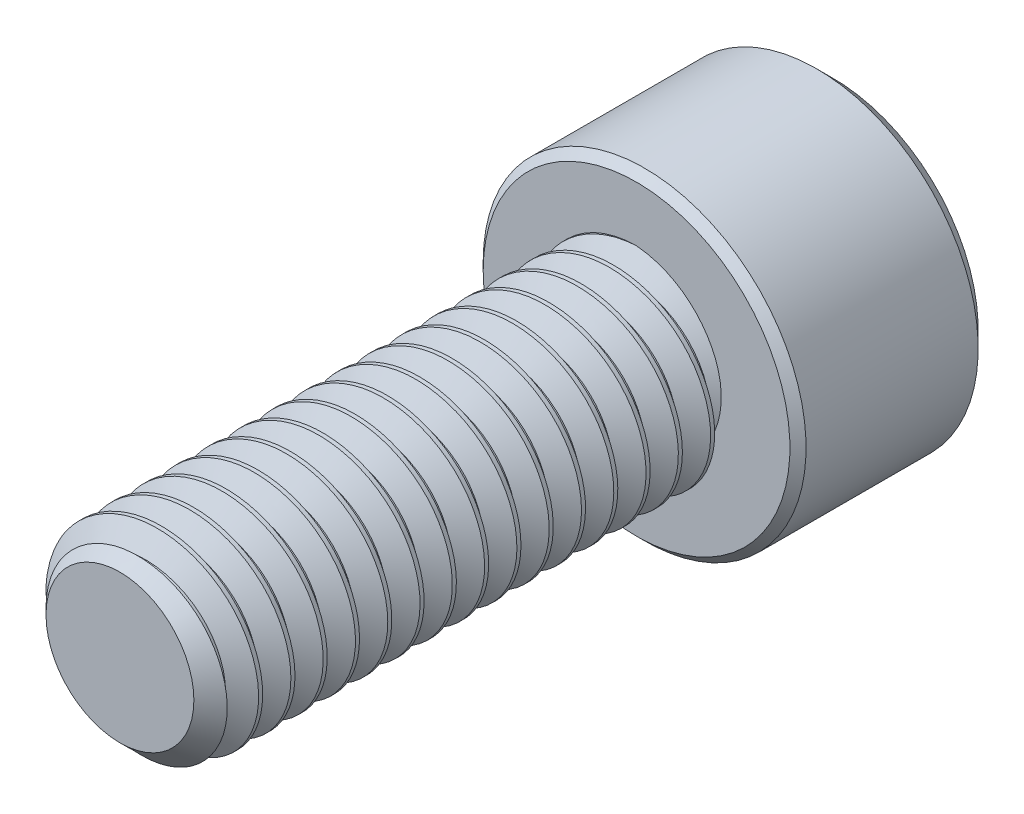
from build123d import *

# Parameters (mm, degrees)
SKETCH1_R          = 2.413
EXTRUDE1_DEPTH     = 12.7
CHAMFER3_SIZE      = 0.5953125
CUT_SWEEP1_PITCH   = 0.79375
SKETCH6_R          = 3.96875
EXTRUDE2_DEPTH     = 4.826
CUT_EXTRUDE1_DEPTH = 2.9765625
CHAMFER1_SIZE      = 0.396875
CHAMFER2_SIZE      = 0.1984375


with BuildPart() as part:
    # Sketch1 → Extrude1 (new body)
    with BuildSketch(Plane.XY):
        Circle(SKETCH1_R)
    extrude(amount=-EXTRUDE1_DEPTH)

    # Chamfer3
    chamfer3_edges = [part.edges().sort_by_distance(p)[0] for p in [
        (-2.413, 0, 0),
    ]]
    chamfer(chamfer3_edges, length=CHAMFER3_SIZE)

    # Cut-Sweep1: the profile of Sketch3 profile screwed along a right-hand helix of 17 turns, 6 arcs to a turn; built about Z, then put on its axis
    cut_sweep1_z = Axis((0, 0, 0), (0, 0, 1))
    cut_sweep1_corners = [(2.4133, 0, -0.694704455), (1.897444252, 0, -0.396875), (1.897444252, 0, -0.29765625), (2.4133, 0, 0.000173205)]
    with BuildLine(mode=Mode.PRIVATE) as cut_sweep1_profile:
        Line(cut_sweep1_corners[0], cut_sweep1_corners[1])
        Line(cut_sweep1_corners[1], cut_sweep1_corners[2])
        Line(cut_sweep1_corners[2], cut_sweep1_corners[3])
        Line(cut_sweep1_corners[3], cut_sweep1_corners[0])
    cut_sweep1_cap = Face(cut_sweep1_profile.wire())
    cut_sweep1_turn_angles = [0, 30, 60, 90, 120, 150, 180, 210, 240, 270, 300, 330, 360]
    cut_sweep1_turn_weights = [1, 0.8660254037844387, 1, 0.8660254037844387, 1, 0.8660254037844387, 1, 0.8660254037844387, 1, 0.8660254037844387, 1, 0.8660254037844387, 1]
    cut_sweep1_turn_rails = [Edge.make_bspline([Vector(p[0], p[1], 0).rotate(cut_sweep1_z, cut_sweep1_turn_angles[k]) / cut_sweep1_turn_weights[k] + Vector(0, 0, p[2] + CUT_SWEEP1_PITCH * cut_sweep1_turn_angles[k] / 360) for k in range(13)], [0, 0, 0, 1, 1, 2, 2, 3, 3, 4, 4, 5, 5, 6, 6, 6], 2, cut_sweep1_turn_weights) for p in cut_sweep1_corners]
    cut_sweep1_turn_sides = [Face.make_surface_from_curves(cut_sweep1_turn_rails[p[0]], cut_sweep1_turn_rails[p[1]]) for p in [(0, 1), (1, 2), (2, 3), (3, 0)]]
    cut_sweep1 = Plane(origin=(0, 0, 0), x_dir=(0, 1, 0), z_dir=(0, 0, -1)) * Solid(Shell([*[p.moved(Location((0, 0, CUT_SWEEP1_PITCH * i))) for i in range(17) for p in cut_sweep1_turn_sides], cut_sweep1_cap, cut_sweep1_cap.rotate(cut_sweep1_z, 6120).moved(Location((0, 0, CUT_SWEEP1_PITCH * 6120 / 360)))]))
    add(cut_sweep1, mode=Mode.SUBTRACT)

    # Sketch6 → Extrude2 (add)
    with BuildSketch(Plane(origin=(0, 0, -12.7), x_dir=(-1, 0, 0), z_dir=(0, 0, -1))):
        Circle(SKETCH6_R)
    extrude(amount=EXTRUDE2_DEPTH)

    # Sketch7 → Cut-Extrude1 (cut)
    with BuildSketch(Plane(origin=(0, 0, -17.526), x_dir=(-1, 0, 0), z_dir=(0, 0, -1))):
        Polygon((0, 2.291358881), (-1.984375, 1.14567944), (-1.984375, -1.14567944), (0, -2.291358881), (1.984375, -1.14567944), (1.984375, 1.14567944), align=None)
    extrude(amount=-CUT_EXTRUDE1_DEPTH, mode=Mode.SUBTRACT)

    # Cut-Extrude2 cone 1 section (through the dimple's axis) → Cut-Extrude2 (revolve, cut)
    with BuildSketch(Plane(origin=(0, 0, -17.526), x_dir=(0, 1, 0), z_dir=(1, 0, 0))):
        Polygon((0, 0), (2.291358881, 0), (0, 2.291358881), align=None)
    revolve(axis=Axis((0, 0, -17.526), (0, 0, 1)), mode=Mode.SUBTRACT)

    # Chamfer1
    chamfer1_edges = [part.edges().sort_by_distance(p)[0] for p in [
        (3.96875, 0, -17.526),
    ]]
    chamfer(chamfer1_edges, length=CHAMFER1_SIZE)

    # Chamfer2
    chamfer2_edges = [part.edges().sort_by_distance(p)[0] for p in [
        (3.96875, 0, -12.7),
    ]]
    chamfer(chamfer2_edges, length=CHAMFER2_SIZE)


solid = part.part
